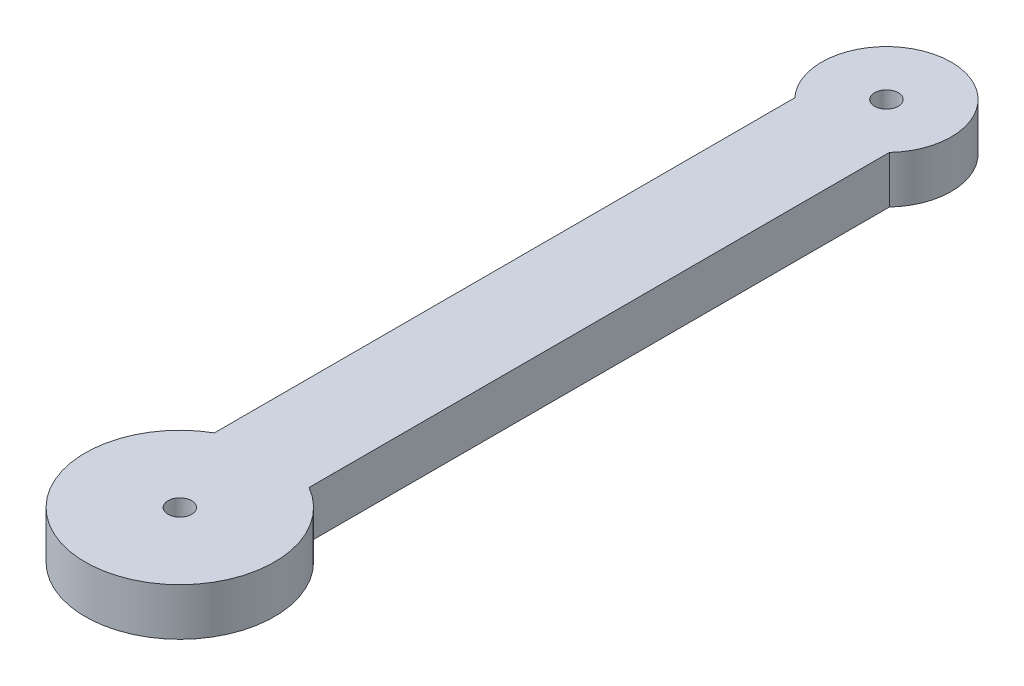
from build123d import *

# Parameters (mm, degrees)
SKETCH2_R           = 0.625
BOSS_EXTRUDE1_DEPTH = 2.5


with BuildPart() as part:
    # Sketch2 → Boss-Extrude1 (new body)
    with BuildSketch(Plane(origin=(0, 0, 0), x_dir=(1, 0, 0), z_dir=(0, 1, 0))):
        with BuildLine():
            Line((-2.5, 35), (-2.5, 4.330127019))
            ThreePointArc((-2.5, 4.330127019), (0, -5), (2.5, 4.330127019))
            Line((2.5, 4.330127019), (2.5, 35))
            ThreePointArc((2.5, 35), (0, 40.768904363), (-2.5, 35))
        make_face()
        Circle(SKETCH2_R, mode=Mode.SUBTRACT)
        with Locations((0, 37.342754867)):
            Circle(SKETCH2_R, mode=Mode.SUBTRACT)
    extrude(amount=BOSS_EXTRUDE1_DEPTH)


solid = part.part
